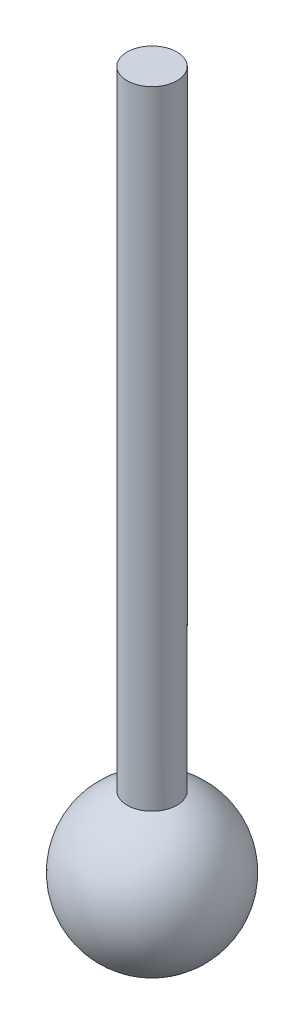
from build123d import *


with BuildPart() as part:
    # Sketch1 → Revolve1 (revolve)
    with BuildSketch(Plane.YZ):
        with BuildLine():
            Line((158.75, 6.35), (-1.089487758, 6.35))
            ThreePointArc((-1.089487758, 6.35), (-22.271392695, 18.775652561), (-38.1, 0))
            Line((-38.1, 0), (158.75, 0))
            Line((158.75, 0), (158.75, 6.35))
        make_face()
    revolve(axis=Axis((0, 0, 0), (0, 1, 0)))


solid = part.part
